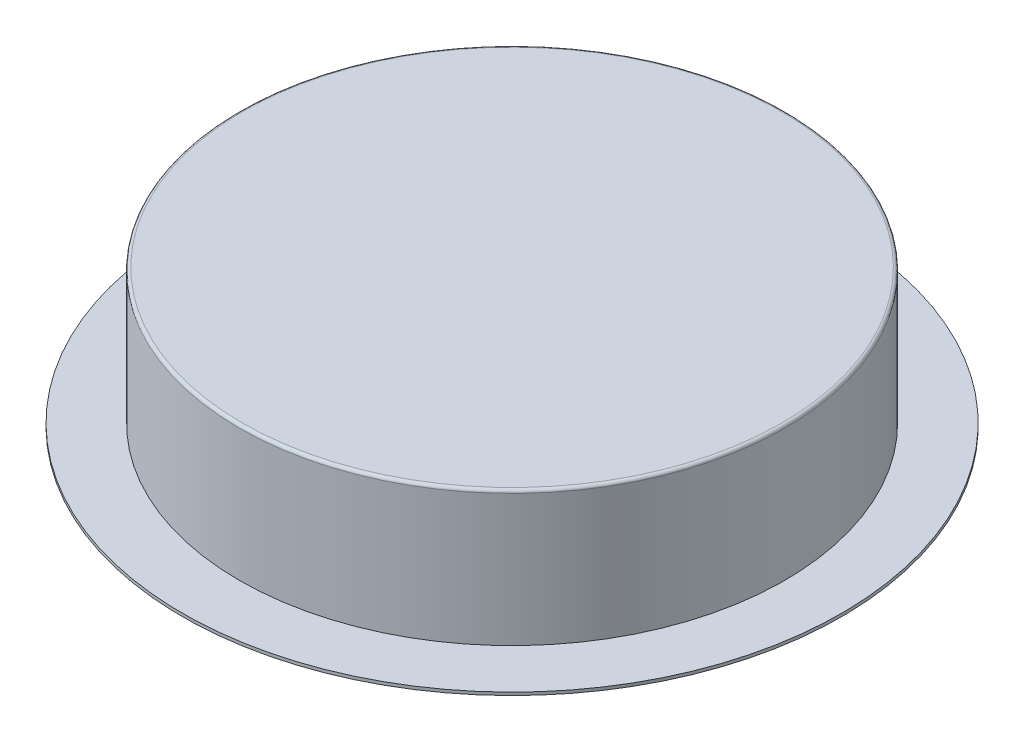
from build123d import *

# Parameters (mm, degrees)
SKETCH_1_R      = 45.5
SKETCH_1_R_2    = 45
EXTRUDE_1_DEPTH = 22
SKETCH_2_R      = 55
SKETCH_2_R_2    = 45
EXTRUDE_2_DEPTH = 0.5
SKETCH_3_R      = 45.5
EXTRUDE_3_DEPTH = 0.5
FILLET_2_R      = 0.5


with BuildPart() as part:
    # Эскиз1 → Вытянуть1 (new body)
    with BuildSketch(Plane(origin=(0, 0, 0), x_dir=(1, 0, 0), z_dir=(0, 1, 0))):
        Circle(SKETCH_1_R)
        Circle(SKETCH_1_R_2, mode=Mode.SUBTRACT)
    extrude(amount=EXTRUDE_1_DEPTH)

    # Эскиз3 → Вытянуть3 (add)
    with BuildSketch(Plane(origin=(0, 22, 0), x_dir=(1, 0, 0), z_dir=(0, 1, 0))):
        Circle(SKETCH_3_R)
    extrude(amount=EXTRUDE_3_DEPTH)

    # Скругление2
    fillet_2_edges = [part.edges().sort_by_distance(p)[0] for p in [
        (-45.5, 22.5, 0),
    ]]
    fillet(fillet_2_edges, radius=FILLET_2_R)


with BuildPart() as body_2:
    # Эскиз2 → Вытянуть2 (new body)
    with BuildSketch(Plane.XZ):
        Circle(SKETCH_2_R)
        Circle(SKETCH_2_R_2, mode=Mode.SUBTRACT)
    extrude(amount=EXTRUDE_2_DEPTH)


solid = Compound([part.part, body_2.part])
